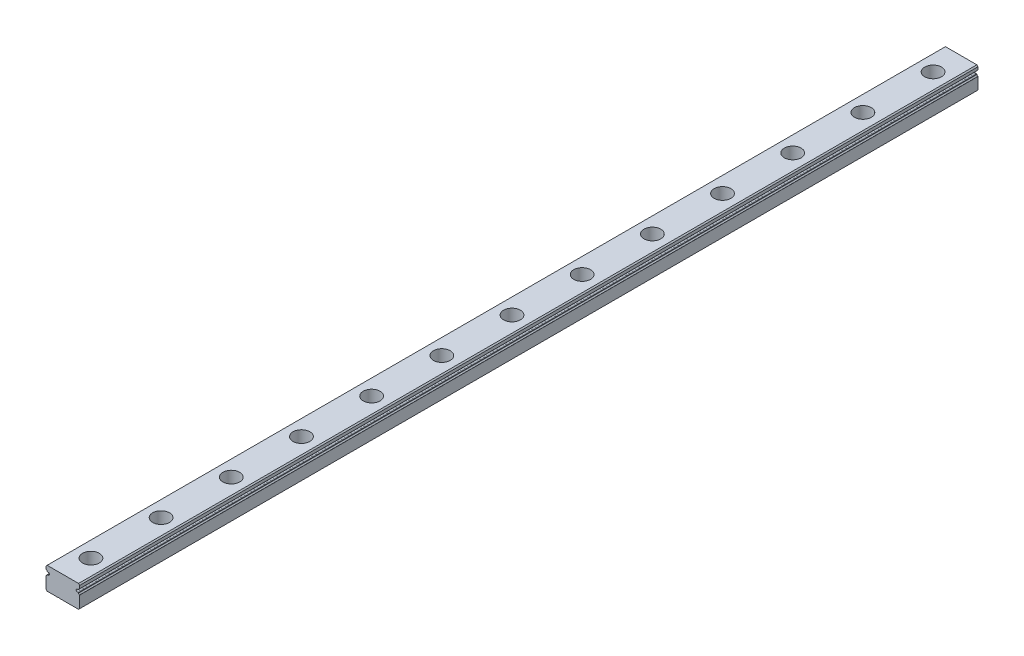
from build123d import *

# Parameters (mm, degrees)
CROQUIS1_W                                           = 12
CROQUIS1_H                                           = 500
SALIENTE_EXTRUIR1_DEPTH                              = 8
CORTAR_EXTRUIR1_DEPTH                                = 501.05240509
CORTAR_EXTRUIR2_DEPTH                                = 501.05240509
CORTAR_EXTRUIR3_DEPTH                                = 501.05240509
CORTAR_EXTRUIR4_DEPTH                                = 501.05240509
CORTAR_EXTRUIR5_DEPTH                                = 501.05240509
CORTAR_EXTRUIR6_DEPTH                                = 501.05240509
CORTAR_EXTRUIR7_DEPTH                                = 501.05240509
REFRENTADO_PARA_TORNILLO_CON_CABEZA_HEXA_D           = 3.5
REFRENTADO_PARA_TORNILLO_CON_CABEZA_HEXA_CBORE_D     = 6
REFRENTADO_PARA_TORNILLO_CON_CABEZA_HEXA_CBORE_DEPTH = 4.5
CHAFL_N1_SIZE                                        = 0.4
CHAFL_N2_SIZE                                        = 0.034056407
CHAFL_N2_SIZE_2                                      = 0.03688403
CHAFL_N3_SIZE                                        = 0.091173812
CHAFL_N3_SIZE_2                                      = 0.105000846
CROQUIS11_W                                          = 21.39366532
CROQUIS11_H                                          = 19.512682309
CORTAR_EXTRUIR8_DEPTH                                = 180


with BuildPart() as part:
    # Croquis1 → Saliente-Extruir1 (new body)
    with BuildSketch(Plane(origin=(0, 4.050658692, 0), x_dir=(1, 0, 0), z_dir=(0, 1, 0))):
        Rectangle(CROQUIS1_W, CROQUIS1_H)
    extrude(amount=-SALIENTE_EXTRUIR1_DEPTH)

    # Croquis2 → Cortar-Extruir1 (cut, through all)
    with BuildSketch(Plane(origin=(0, 0, -250), x_dir=(-1, 0, 0), z_dir=(0, 0, -1))):
        with BuildLine():
            Line((1.35, -3.949341308), (1.85, -3.949341308))
            ThreePointArc((1.85, -3.949341308), (1.6, -3.849341308), (1.35, -3.949341308))
        make_face()
    extrude(amount=-CORTAR_EXTRUIR1_DEPTH, mode=Mode.SUBTRACT)

    # Croquis3 → Cortar-Extruir2 (cut, through all)
    with BuildSketch(Plane(origin=(0, 0, -250), x_dir=(-1, 0, 0), z_dir=(0, 0, -1))):
        with BuildLine():
            Line((-6, 2.100658692), (-6, 1.200658692))
            Line((-6, 1.200658692), (-5.2, 1.200658692))
            ThreePointArc((-5.2, 1.200658692), (-4.75, 1.650658692), (-5.2, 2.100658692))
            Line((-5.2, 2.100658692), (-6, 2.100658692))
        make_face()
    extrude(amount=-CORTAR_EXTRUIR2_DEPTH, mode=Mode.SUBTRACT)

    # Croquis4 → Cortar-Extruir3 (cut, through all)
    with BuildSketch(Plane(origin=(0, 0, -250), x_dir=(-1, 0, 0), z_dir=(0, 0, -1))):
        with BuildLine():
            Line((-5.622557264, 1.200658692), (-6, 1.200658692))
            Line((-6, 1.200658692), (-6, 0.689297919))
            ThreePointArc((-6, 0.689297919), (-5.684900038, 0.851696449), (-5.622557264, 1.200658692))
        make_face()
    extrude(amount=-CORTAR_EXTRUIR3_DEPTH, mode=Mode.SUBTRACT)

    # Croquis5 → Cortar-Extruir4 (cut, through all)
    with BuildSketch(Plane(origin=(0, 0, -250), x_dir=(-1, 0, 0), z_dir=(0, 0, -1))):
        with BuildLine():
            Line((-6, 2.612019466), (-6, 2.100658692))
            Line((-6, 2.100658692), (-5.622557264, 2.100658692))
            ThreePointArc((-5.622557264, 2.100658692), (-5.684900038, 2.449620935), (-6, 2.612019466))
        make_face()
    extrude(amount=-CORTAR_EXTRUIR4_DEPTH, mode=Mode.SUBTRACT)

    # Croquis6 → Cortar-Extruir5 (cut, through all)
    with BuildSketch(Plane(origin=(0, 0, -250), x_dir=(-1, 0, 0), z_dir=(0, 0, -1))):
        with BuildLine():
            Line((6, 1.200658692), (6, 2.100658692))
            Line((6, 2.100658692), (5.2, 2.100658692))
            ThreePointArc((5.2, 2.100658692), (4.75, 1.650658692), (5.2, 1.200658692))
            Line((5.2, 1.200658692), (6, 1.200658692))
        make_face()
    extrude(amount=-CORTAR_EXTRUIR5_DEPTH, mode=Mode.SUBTRACT)

    # Croquis7 → Cortar-Extruir6 (cut, through all)
    with BuildSketch(Plane(origin=(0, 0, -250), x_dir=(-1, 0, 0), z_dir=(0, 0, -1))):
        with BuildLine():
            Line((5.622557264, 2.100658692), (6, 2.100658692))
            Line((6, 2.100658692), (6, 2.612019466))
            ThreePointArc((6, 2.612019466), (5.684900038, 2.449620935), (5.622557264, 2.100658692))
        make_face()
    extrude(amount=-CORTAR_EXTRUIR6_DEPTH, mode=Mode.SUBTRACT)

    # Croquis8 → Cortar-Extruir7 (cut, through all)
    with BuildSketch(Plane(origin=(0, 0, -250), x_dir=(-1, 0, 0), z_dir=(0, 0, -1))):
        with BuildLine():
            Line((6, 0.689297919), (6, 1.200658692))
            Line((6, 1.200658692), (5.622557264, 1.200658692))
            ThreePointArc((5.622557264, 1.200658692), (5.684900038, 0.851696449), (6, 0.689297919))
        make_face()
    extrude(amount=-CORTAR_EXTRUIR7_DEPTH, mode=Mode.SUBTRACT)

    # Refrentado para tornillo con cabeza hexagonal de M31 (through all)
    with Locations(Plane(origin=(0, 4.050658692, 0), x_dir=(1, 0, 0), z_dir=(0, 1, 0))):
        with Locations((0, -240), (0, -215), (0, -190), (0, -165), (0, -140), (0, -115), (0, -90), (0, -65), (0, -40), (0, -15), (0, 10), (0, 35), (0, 60), (0, 85), (0, 110), (0, 135), (0, 160), (0, 185), (0, 210), (0, 235)):
            CounterBoreHole(REFRENTADO_PARA_TORNILLO_CON_CABEZA_HEXA_D / 2, REFRENTADO_PARA_TORNILLO_CON_CABEZA_HEXA_CBORE_D / 2, REFRENTADO_PARA_TORNILLO_CON_CABEZA_HEXA_CBORE_DEPTH)

    # Chaflán1
    chafl_n1_edges = [part.edges().sort_by_distance(p)[0] for p in [
        (-6, -3.949341308, 0),
        (6, -3.949341308, 0),
        (-6, 4.050658692, 0),
        (6, 4.050658692, 0),
    ]]
    chamfer(chafl_n1_edges, length=CHAFL_N1_SIZE)

    # Chaflán2
    # the kernel refuses this chamfer: 0.03688403, 0.034056407 mm, written as the material it takes off along each edge
    with BuildSketch(Plane(origin=(6, 0.689297919, -250.100435582), x_dir=(-0.9978479381588691, 0.06557051404475742, 0), z_dir=(0, 0, 1))) as chafl_n2_piece_1:
        with BuildLine():
            Line((0.03902449, 0), (-CHAFL_N2_SIZE * 0.0655705141026, CHAFL_N2_SIZE * 0.997847939043))
            Line((-CHAFL_N2_SIZE * 0.0655705141026, CHAFL_N2_SIZE * 0.997847939043), (0, 0))
            ThreePointArc((0, 0), (0.020082989, 0.000475786), (0.03902449, 0))
        make_face()
    extrude(amount=500.200871164, mode=Mode.SUBTRACT)
    with BuildSketch(Plane(origin=(6, 2.612019466, -250.094971685), x_dir=(0, 1, 0), z_dir=(0, 0, 1))) as chafl_n2_piece_2:
        with BuildLine():
            Line((CHAFL_N2_SIZE_2 * 0.999999990825, 0), (-0.002179894, 0.035512658))
            ThreePointArc((-0.002179894, 0.035512658), (-0.000727719, 0.018309495), (0, 0))
            Line((0, 0), (CHAFL_N2_SIZE_2 * 0.999999990825, 0))
        make_face()
    extrude(amount=500.189943371, mode=Mode.SUBTRACT)
    with BuildSketch(Plane(origin=(-6, 2.612019466, -250.100435582), x_dir=(0, 1, 0), z_dir=(0, 0, 1))) as chafl_n2_piece_3:
        with BuildLine():
            Line((CHAFL_N2_SIZE, 0), (-0.002558856, -0.038940507))
            ThreePointArc((-0.002558856, -0.038940507), (-0.00084209, -0.020070966), (0, 0))
            Line((0, 0), (CHAFL_N2_SIZE, 0))
        make_face()
    extrude(amount=500.200871164, mode=Mode.SUBTRACT)
    with BuildSketch(Plane(origin=(-6, 0.689297919, -250.094971685), x_dir=(0.9981213351064977, 0.061268265890444186, 0), z_dir=(0, 0, 1))) as chafl_n2_piece_4:
        with BuildLine():
            Line((0.0355795, 0), (-CHAFL_N2_SIZE_2 * 0.0612682653281, -CHAFL_N2_SIZE_2 * 0.998121325949))
            Line((-CHAFL_N2_SIZE_2 * 0.0612682653281, -CHAFL_N2_SIZE_2 * 0.998121325949), (0, 0))
            ThreePointArc((0, 0), (0.018319684, -0.000395439), (0.0355795, 0))
        make_face()
    extrude(amount=500.189943371, mode=Mode.SUBTRACT)

    # Chaflán3
    # the kernel refuses this chamfer: 0.105000846, 0.091173812 mm, written as the material it takes off along each edge
    with BuildSketch(Plane(origin=(5.622557264, 1.200658692, -250.318147751), x_dir=(-0.1263625484615496, -0.991984126055605, 0), z_dir=(0, 0, 1)), Plane(origin=(-5.622557264, 2.100658692, -250.318147751), x_dir=(0.12636254846156672, 0.9919841260556028, 0), z_dir=(0, 0, 1))) as chafl_n3_piece_1:
        with BuildLine():
            Line((0.123959197, 0), (CHAFL_N3_SIZE * 0.126362548546, -CHAFL_N3_SIZE * 0.99198412672))
            Line((CHAFL_N3_SIZE * 0.126362548546, -CHAFL_N3_SIZE * 0.99198412672), (0, 0))
            ThreePointArc((0, 0), (0.063641461, -0.004827559), (0.123959197, 0))
        make_face()
    extrude(amount=500.636295502, mode=Mode.SUBTRACT)
    with BuildSketch(Plane(origin=(5.622557264, 2.100658692, -250.269677179), x_dir=(-1, 0, 0), z_dir=(0, 0, 1)), Plane(origin=(-5.622557264, 1.200658692, -250.269677179), x_dir=(1, 0, 0), z_dir=(0, 0, 1))) as chafl_n3_piece_2:
        with BuildLine():
            Line((CHAFL_N3_SIZE_2, 0), (0.015616157, -0.098323158))
            ThreePointArc((0.015616157, -0.098323158), (0.011085216, -0.04998658), (0, 0))
            Line((0, 0), (CHAFL_N3_SIZE_2, 0))
        make_face()
    extrude(amount=500.539354358, mode=Mode.SUBTRACT)

    # Croquis11 → Cortar-Extruir8 (cut)
    with BuildSketch(Plane(origin=(0, 0, -250), x_dir=(-1, 0, 0), z_dir=(0, 0, -1))):
        with Locations((-0.979177693, 1.955889883)):
            Rectangle(CROQUIS11_W, CROQUIS11_H)
    extrude(amount=-CORTAR_EXTRUIR8_DEPTH, mode=Mode.SUBTRACT)


solid = part.part
